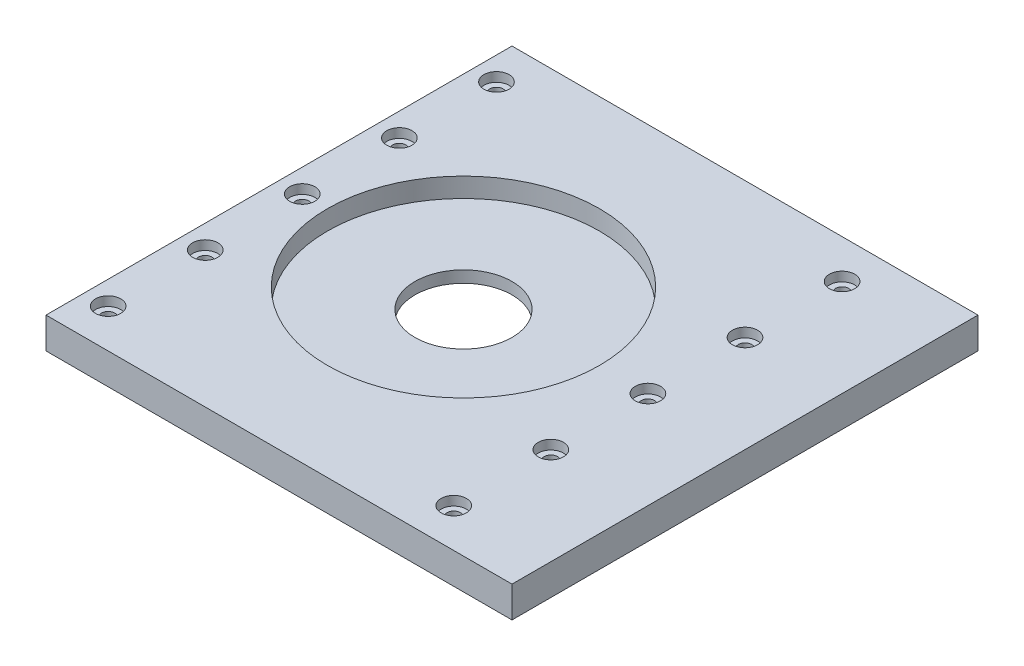
from build123d import *

# Parameters (mm, degrees)
SKETCH1_W                                            = 120
SKETCH1_H                                            = 120
BOSS_EXTRUDE1_DEPTH                                  = 8
CBORE_FOR_M3_HEX_SOCKET_THIN_HEAD_CAP_SC_D           = 3.4
CBORE_FOR_M3_HEX_SOCKET_THIN_HEAD_CAP_SC_CBORE_D     = 6.5
CBORE_FOR_M3_HEX_SOCKET_THIN_HEAD_CAP_SC_CBORE_DEPTH = 2.4
F_25_0MM_DOWEL_HOLE1_D                               = 25
F_25_0MM_DOWEL_HOLE1_DEPTH                           = 10
F_25_0MM_DOWEL_HOLE1_TIP                             = 7.510757738
SKETCH7_R                                            = 35
CUT_EXTRUDE1_DEPTH                                   = 5


with BuildPart() as part:
    # Sketch1 → Boss-Extrude1 (new body)
    with BuildSketch(Plane(origin=(0, 0, 0), x_dir=(1, 0, 0), z_dir=(0, 1, 0))):
        with Locations((60, 60)):
            Rectangle(SKETCH1_W, SKETCH1_H)
    extrude(amount=BOSS_EXTRUDE1_DEPTH)

    # CBORE for M3 Hex Socket Thin Head Cap Screw1 (through all)
    with Locations(Plane(origin=(0, 8, 0), x_dir=(1, 0, 0), z_dir=(0, 1, 0))):
        with Locations((95, 110), (6, 110), (6, 85), (6, 60), (6, 35), (6, 10), (95, 60), (95, 35), (95, 10), (95, 85)):
            CounterBoreHole(CBORE_FOR_M3_HEX_SOCKET_THIN_HEAD_CAP_SC_D / 2, CBORE_FOR_M3_HEX_SOCKET_THIN_HEAD_CAP_SC_CBORE_D / 2, CBORE_FOR_M3_HEX_SOCKET_THIN_HEAD_CAP_SC_CBORE_DEPTH)

    # Ø25.0mm Dowel Hole1
    with Locations(Plane(origin=(0, 8, 0), x_dir=(1, 0, 0), z_dir=(0, 1, 0))):
        with Locations((47.5, 60)):
            Hole(F_25_0MM_DOWEL_HOLE1_D / 2, depth=F_25_0MM_DOWEL_HOLE1_DEPTH)
            with Locations((0, 0, -(F_25_0MM_DOWEL_HOLE1_DEPTH + F_25_0MM_DOWEL_HOLE1_TIP / 2))):  # 118° drill point
                Cone(0, F_25_0MM_DOWEL_HOLE1_D / 2, F_25_0MM_DOWEL_HOLE1_TIP, mode=Mode.SUBTRACT)

    # Sketch7 → Cut-Extrude1 (cut)
    with BuildSketch(Plane(origin=(0, 8, 0), x_dir=(1, 0, 0), z_dir=(0, 1, 0))):
        with Locations((47.5, 60)):
            Circle(SKETCH7_R)
    extrude(amount=-CUT_EXTRUDE1_DEPTH, mode=Mode.SUBTRACT)


solid = part.part
